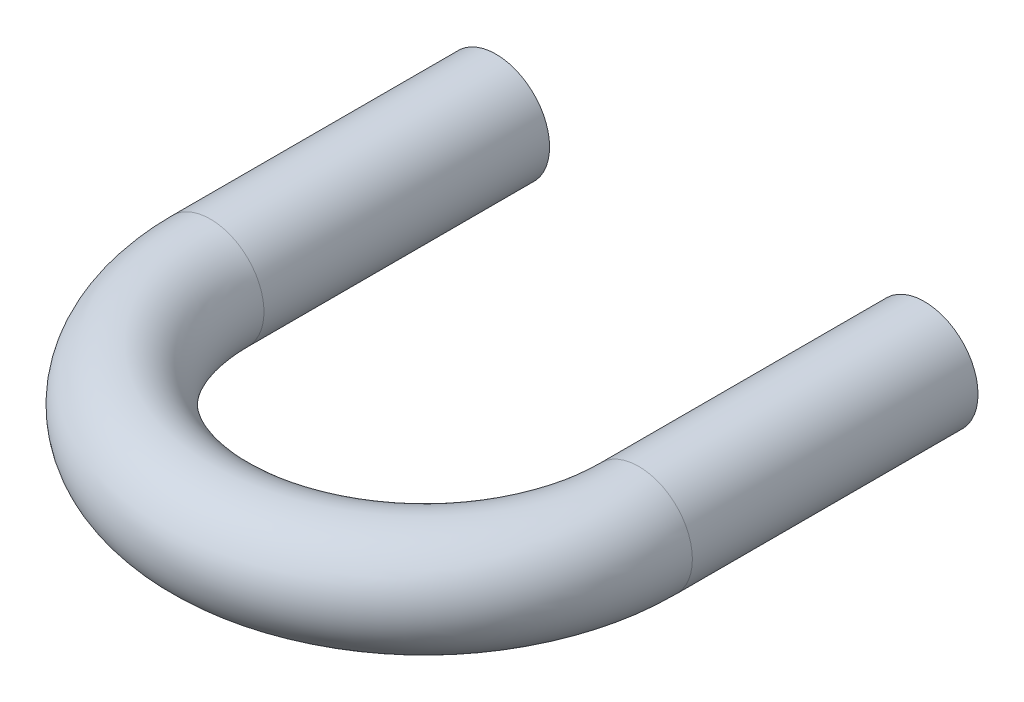
from build123d import *

# Parameters (mm, degrees)
SKETCH1_R             = 7.5
BOSS_EXTRUDE1_DEPTH   = 40
BOSS_EXTRUDE1_2_DEPTH = 40
SWEEP1_OUTLINE_R      = 7.5
SWEEP1_ANGLE          = 180


# Read off the part's stored shape, not the designer's step: Sweep1
with BuildPart() as part:
    # Sketch1 → Boss-Extrude1 (new body)
    with BuildSketch(Plane.XY):
        with Locations((30, 0)):
            Circle(SKETCH1_R)
    extrude(amount=BOSS_EXTRUDE1_DEPTH)



with BuildPart() as body_2:
    # Sketch1 → Boss-Extrude1 2 (new body)
    with BuildSketch(Plane.XY):
        with Locations((-30, 0)):
            Circle(SKETCH1_R)
    extrude(amount=BOSS_EXTRUDE1_2_DEPTH)


with BuildPart() as part_1:
    add(part.part)

    add(body_2.part)  # Sweep1 merges body 2
    # Sweep1 outline → Sweep1 (revolve)
    with BuildSketch(Plane(origin=(0, 0, 40), x_dir=(-1, 0, 0), z_dir=(0, 0, -1))):
        with Locations((30, 0)):
            Circle(SWEEP1_OUTLINE_R)
    revolve(axis=Axis((0, 0, 40), (0, 1, 0)), revolution_arc=SWEEP1_ANGLE)


solid = part_1.part
